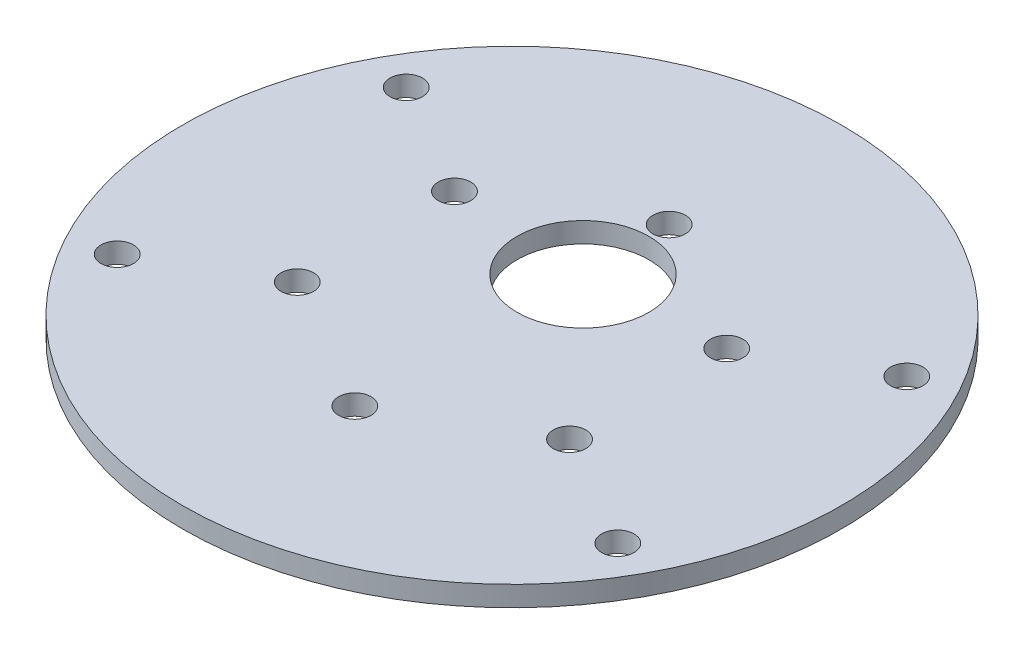
from build123d import *

# Parameters (mm, degrees)
SKETCH_1_R      = 32.5
SKETCH_1_R_2    = 1.6
SKETCH_1_R_3    = 6.5
EXTRUDE_1_DEPTH = 2


with BuildPart() as part:
    # 草图1 → 凸台-拉伸1 (new body)
    with BuildSketch(Plane(origin=(0, 0, 0), x_dir=(1, 0, 0), z_dir=(0, 1, 0))):
        Circle(SKETCH_1_R)
        with Locations((-24.681724008, -14.25)):
            Circle(SKETCH_1_R_2, mode=Mode.SUBTRACT)
        with Locations((0, 7)):
            Circle(SKETCH_1_R_3, mode=Mode.SUBTRACT)
        with Locations((24.681724008, 14.25)):
            Circle(SKETCH_1_R_2, mode=Mode.SUBTRACT)
        with Locations((0, 15.5)):
            Circle(SKETCH_1_R_2, mode=Mode.SUBTRACT)
        with Locations((13.423393759, 7.75)):
            Circle(SKETCH_1_R_2, mode=Mode.SUBTRACT)
        with Locations((13.423393759, -7.75)):
            Circle(SKETCH_1_R_2, mode=Mode.SUBTRACT)
        with Locations((0, -15.5)):
            Circle(SKETCH_1_R_2, mode=Mode.SUBTRACT)
        with Locations((-13.423393759, -7.75)):
            Circle(SKETCH_1_R_2, mode=Mode.SUBTRACT)
        with Locations((-13.423393759, 7.75)):
            Circle(SKETCH_1_R_2, mode=Mode.SUBTRACT)
        with Locations((24.681724008, -14.25)):
            Circle(SKETCH_1_R_2, mode=Mode.SUBTRACT)
        with Locations((-24.681724008, 14.25)):
            Circle(SKETCH_1_R_2, mode=Mode.SUBTRACT)
    extrude(amount=EXTRUDE_1_DEPTH)


solid = part.part
